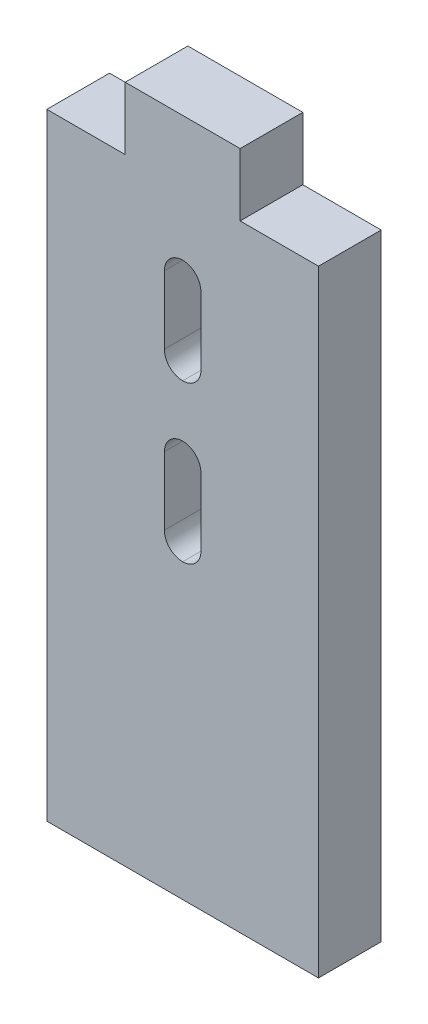
from build123d import *

# Parameters (mm, degrees)
ESBO_O1_W                = 3.5
ESBO_O1_H                = 10
RESSALTO_EXTRUS_O1_DEPTH = 6
FILETE1_R                = 1.75


with BuildPart() as part:
    # Esboço1 → Ressalto-extrusão1 (new body)
    with BuildSketch(Plane.XY):
        Polygon((5.5, 32.5), (0, 32.5), (-5.5, 32.5), (-5.5, 26.5), (-13, 26.5), (-13, -32.5), (13, -32.5), (13, 26.5), (5.5, 26.5), align=None)
        with Locations((0, 15.5)):
            Rectangle(ESBO_O1_W, ESBO_O1_H, mode=Mode.SUBTRACT)
        with Locations((0, 0.5)):
            Rectangle(ESBO_O1_W, ESBO_O1_H, mode=Mode.SUBTRACT)
    extrude(amount=RESSALTO_EXTRUS_O1_DEPTH)

    # Filete1
    filete1_edges = [part.edges().sort_by_distance(p)[0] for p in [
        (-1.75, -4.5, 3),
        (1.75, -4.5, 3),
        (1.75, 5.5, 3),
        (-1.75, 5.5, 3),
        (1.75, 10.5, 3),
        (-1.75, 10.5, 3),
        (1.75, 20.5, 3),
        (-1.75, 20.5, 3),
    ]]
    fillet(filete1_edges, radius=FILETE1_R - 0.0001)  # a hair under: the kernel refuses the full size


solid = part.part
